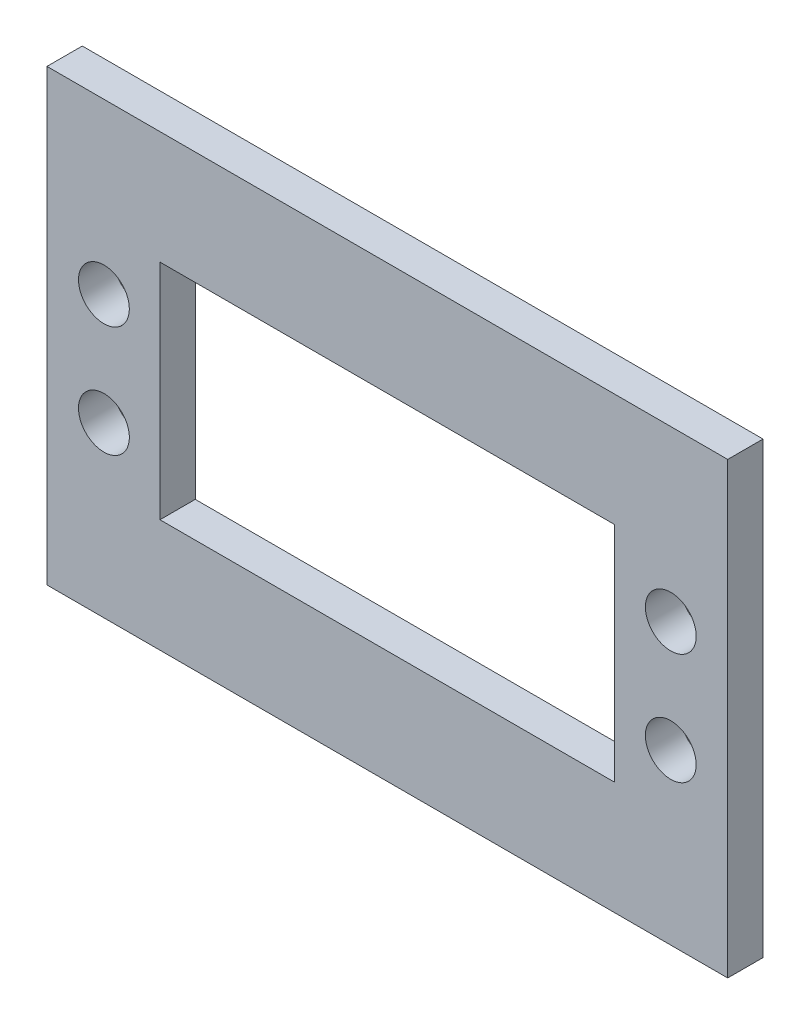
from build123d import *

# Parameters (mm, degrees)
SKETCH1_W           = 61.214
SKETCH1_H           = 40.386
SKETCH1_W_2         = 40.894
SKETCH1_H_2         = 20.066
BOSS_EXTRUDE1_DEPTH = 3.175
SKETCH2_R           = 2.286
CUT_EXTRUDE1_DEPTH  = 60.41550822


with BuildPart() as part:
    # Sketch1 → Boss-Extrude1 (new body)
    with BuildSketch(Plane.XY):
        with Locations((20.447, 10.033)):
            Rectangle(SKETCH1_W, SKETCH1_H)
        with Locations((20.447, 10.033)):
            Rectangle(SKETCH1_W_2, SKETCH1_H_2, mode=Mode.SUBTRACT)
    extrude(amount=BOSS_EXTRUDE1_DEPTH)

    # Sketch2 → Cut-Extrude1 (cut, through all)
    with BuildSketch(Plane.XY.offset(3.175)):
        with Locations((-5.04, 15.033)):
            Circle(SKETCH2_R)
        with Locations((-5.04, 5.033)):
            Circle(SKETCH2_R)
        with Locations((45.934, 5.033)):
            Circle(SKETCH2_R)
        with Locations((45.934, 15.033)):
            Circle(SKETCH2_R)
    extrude(amount=-CUT_EXTRUDE1_DEPTH, mode=Mode.SUBTRACT)


solid = part.part
